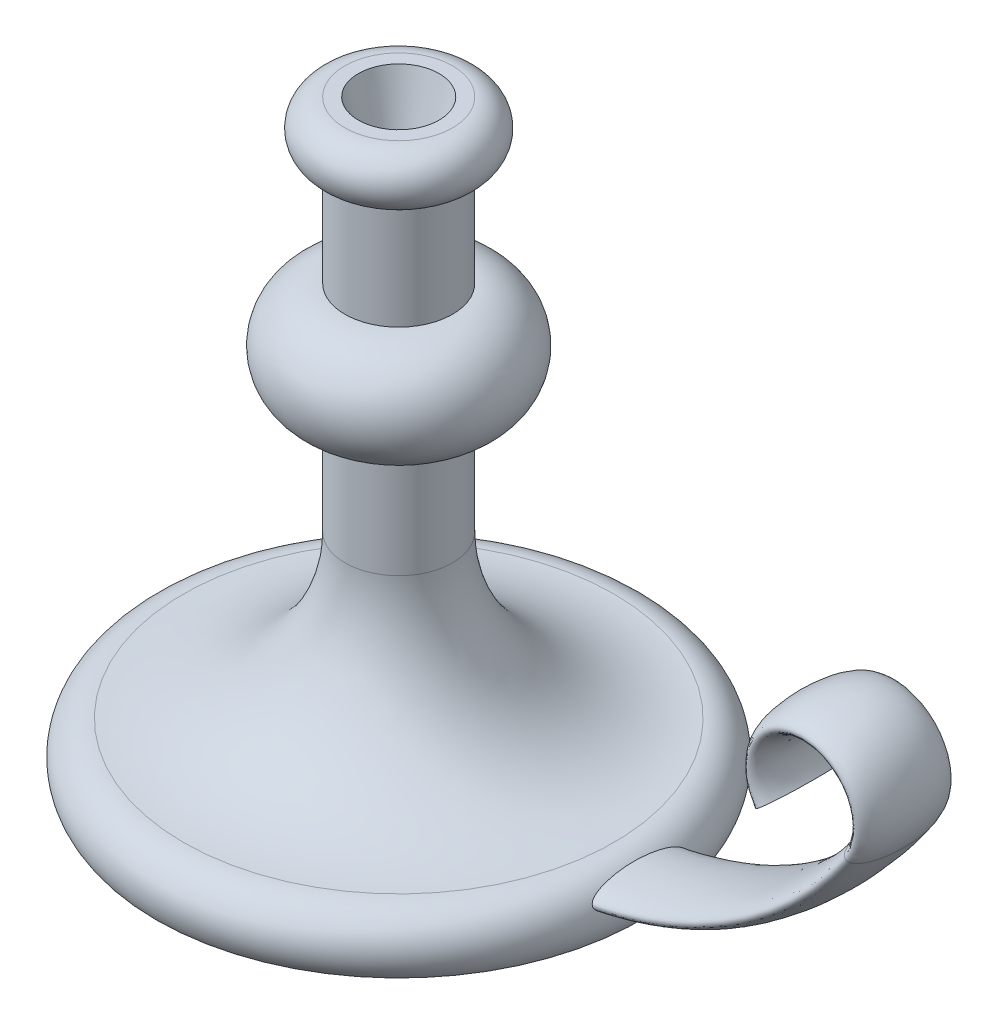
from build123d import *

# Parameters (mm, degrees)
SKETCH3_RX         = 17.5
SKETCH3_RY         = 5
SKETCH4_R          = 15
CUT_EXTRUDE1_DEPTH = 25
CUT_EXTRUDE1_DRAFT = -15


with BuildPart() as part:
    # Sketch1 → Revolve1 (revolve)
    with BuildSketch(Plane.XY):
        with BuildLine():
            Line((0, 0), (0, 220))
            Line((0, 220), (20, 220))
            ThreePointArc((20, 220), (30, 210), (20, 200))
            Line((20, 200), (20, 160))
            ThreePointArc((20, 160), (40, 140), (20, 120))
            Line((20, 120), (20, 80))
            ThreePointArc((20, 80), (37.573593129, 37.573593129), (80, 20))
            ThreePointArc((80, 20), (91.180339887, 13.090169944), (90, 0))
            Line((90, 0), (0, 0))
        make_face()
    revolve(axis=Axis((0, 0, 0), (0, 1, 0)))

    # Sweep1: sweep along a path in Sketch2
    with BuildLine(Plane.XY) as sweep1_path:
        Line((0, 10), (60, 10))
        ThreePointArc((60, 10), (129.821200219, 27.240819526), (183.592070943, 75))
        ThreePointArc((183.592070943, 75), (167.113128151, 106.333333333), (150.634185358, 75))
    # Sketch3 → Sweep1 (sweep)
    with BuildSketch(Plane(origin=(0, 0, 0), x_dir=(0, 0, -1), z_dir=(1, 0, 0))):
        with Locations(Location((0, 10), (0, 0, 180))):
            Ellipse(SKETCH3_RX, SKETCH3_RY)
    sweep(path=sweep1_path.line)


with BuildPart() as cut_extrude1_tool:
    # Sketch4 → Cut-Extrude1 (with draft: the straight prism first)
    with BuildSketch(Plane(origin=(0, 220, 0), x_dir=(1, 0, 0), z_dir=(0, 1, 0))):
        Circle(SKETCH4_R)
    extrude(amount=-CUT_EXTRUDE1_DEPTH)
    # Cut-Extrude1: the draft: its side faces are tilted about the plane it starts from
    cut_extrude1_sides = [cut_extrude1_tool.faces().sort_by_distance(p)[0] for p in [
        (-15, 207.5, 0),
    ]]
    draft(cut_extrude1_sides, Plane(origin=(0, 220, 0), x_dir=(1, 0, 0), z_dir=(0, 1, 0)), CUT_EXTRUDE1_DRAFT)


with BuildPart() as part_1:
    add(part.part)

    # Cut-Extrude1: cut by cut_extrude1_tool
    add(cut_extrude1_tool.part, mode=Mode.SUBTRACT)


solid = part_1.part
